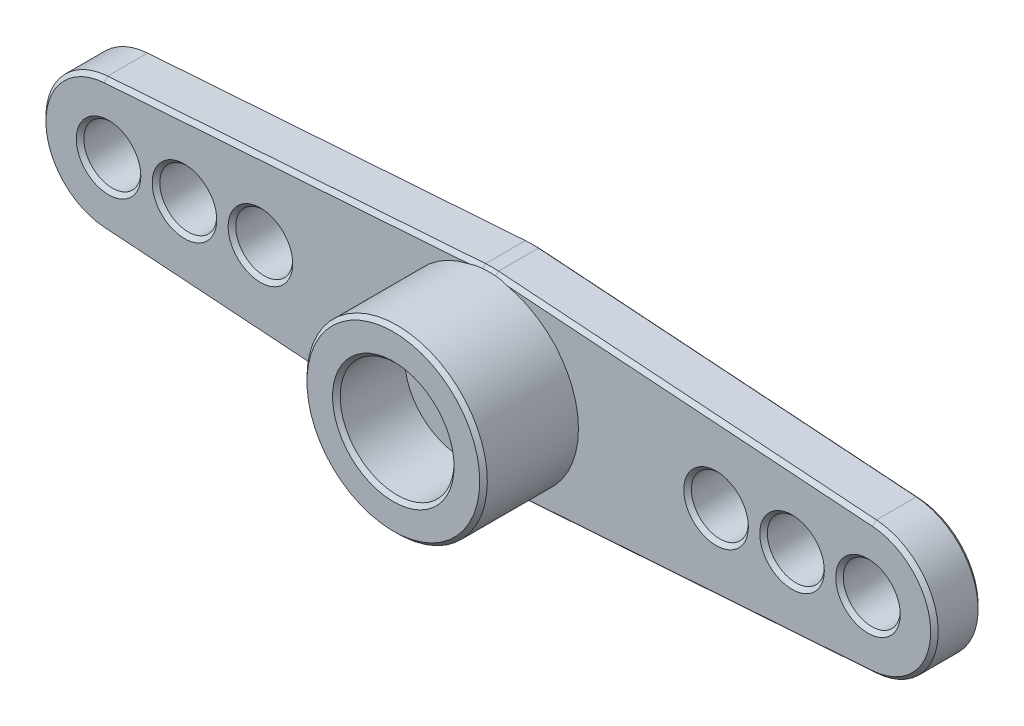
from build123d import *

# Parameters (mm, degrees)
SKETCH_1_R          = 1.5
EXTRUDE_1_DEPTH     = 2.5
SKETCH_2_R          = 4.75
EXTRUDE_2_DEPTH     = 5
SKETCH_3_R          = 3
CUT_EXTRUDE_1_DEPTH = 3.6
CUT_EXTRUDE_START   = -2.2
SKETCH_4_R          = 3
CUT_EXTRUDE_2_DEPTH = 2.2
SKETCH_5_R          = 1.5
CUT_EXTRUDE_3_DEPTH = 3
CHAMFER_1_SIZE      = 0.2


with BuildPart() as part:
    # 草图1 → 凸台-拉伸1 (new body)
    with BuildSketch(Plane.XY):
        with BuildLine():
            Line((0.343, 4.887980258), (20.245, 3.49141447))
            ThreePointArc((20.245, 3.49141447), (23.5, 0), (20.245, -3.49141447))
            Line((20.245, -3.49141447), (0.343, -4.887980258))
            ThreePointArc((0.343, -4.887980258), (0, -4.9), (-0.343, -4.887980258))
            Line((-0.343, -4.887980258), (-20.245, -3.49141447))
            ThreePointArc((-20.245, -3.49141447), (-23.5, 0), (-20.245, 3.49141447))
            Line((-20.245, 3.49141447), (-0.343, 4.887980258))
            ThreePointArc((-0.343, 4.887980258), (0, 4.9), (0.343, 4.887980258))
        make_face()
        with Locations((-12, 0)):
            Circle(SKETCH_1_R, mode=Mode.SUBTRACT)
        with Locations((-16, 0)):
            Circle(SKETCH_1_R, mode=Mode.SUBTRACT)
        with Locations((-20, 0)):
            Circle(SKETCH_1_R, mode=Mode.SUBTRACT)
        with Locations((20, 0)):
            Circle(SKETCH_1_R, mode=Mode.SUBTRACT)
        with Locations((16, 0)):
            Circle(SKETCH_1_R, mode=Mode.SUBTRACT)
        with Locations(Location((12, 0, 0), (0, 0, 180))):
            Circle(SKETCH_1_R, mode=Mode.SUBTRACT)
    extrude(amount=EXTRUDE_1_DEPTH)

    # 草图2 → 凸台-拉伸2 (add)
    with BuildSketch(Plane.XY.offset(2.5)):
        Circle(SKETCH_2_R)
    extrude(amount=EXTRUDE_2_DEPTH)

    # 草图3 → 切除-拉伸1 (cut)
    with BuildSketch(Plane.XY.offset(7.5)):
        Circle(SKETCH_3_R)
    extrude(amount=-CUT_EXTRUDE_1_DEPTH, mode=Mode.SUBTRACT)

    # 草图4 → 切除-拉伸2 (cut)
    with BuildSketch(Plane(origin=(0, 0, 0), x_dir=(-1, 0, 0), z_dir=(0, 0, -1)).offset(CUT_EXTRUDE_START)):
        with Locations(Location((0, 0, 0), (0, 0, 180))):
            Circle(SKETCH_4_R)
    extrude(amount=CUT_EXTRUDE_2_DEPTH, mode=Mode.SUBTRACT)

    # 草图5 → 切除-拉伸3 (cut)
    with BuildSketch(Plane(origin=(0, 0, 2.2), x_dir=(-1, 0, 0), z_dir=(0, 0, -1))):
        Circle(SKETCH_5_R)
    extrude(amount=-CUT_EXTRUDE_3_DEPTH, mode=Mode.SUBTRACT)

    # 倒角1
    # the kernel refuses this chamfer: 0.2 mm, written as the material it takes off along each edge
    with BuildSketch(Plane(origin=(-20, 0, 2.5), x_dir=(-0.06999999999999927, -0.9975469913743413, 0), z_dir=(0.9975469913743413, -0.06999999999999927, 0))) as chamfer_1_piece_1:
        Polygon((3.5, CHAMFER_1_SIZE), (3.5 - CHAMFER_1_SIZE, 0), (3.5, 0), align=None)
    revolve(axis=Axis((-20, 0, 2.5), (0, 0, -1)), revolution_arc=171.972025564, mode=Mode.SUBTRACT)
    with BuildSketch(Plane(origin=(-20.245, 3.49141447, 0), x_dir=(-0.0019247113627411001, 0.027428428988091162, 0.9996219169112966), z_dir=(0.9975469913743413, 0.07000000000000042, 0))) as chamfer_1_piece_2:
        Polygon((CHAMFER_1_SIZE * 0.999621916911, CHAMFER_1_SIZE * 0.0274958766106), (-CHAMFER_1_SIZE * 0.0274958766106, CHAMFER_1_SIZE * 0.999621916911), (0, 0), align=None)
    extrude(amount=19.950939827, mode=Mode.SUBTRACT)
    with BuildSketch(Plane(origin=(0, 0, 0), x_dir=(-0.0700000000000013, 0.9975469913743411, 0), z_dir=(-0.9975469913743411, -0.0700000000000013, 0))) as chamfer_1_piece_3:
        Polygon((4.9, -CHAMFER_1_SIZE), (4.9 - CHAMFER_1_SIZE, 0), (4.9, 0), align=None)
    revolve(axis=Axis((0, 0, 0), (0, 0, -1)), revolution_arc=8.027974436, mode=Mode.SUBTRACT)
    with BuildSketch(Plane(origin=(-0.343, -4.887980258, 2.5), x_dir=(0.06997353418379068, 0.9971698357267157, 0.02749587661058734), z_dir=(-0.9975469913743412, 0.06999999999999992, 0))) as chamfer_1_piece_4_section:
        Polygon((CHAMFER_1_SIZE * 0.999621916911, CHAMFER_1_SIZE * 0.0274958766106), (-CHAMFER_1_SIZE * 0.0274958766106, CHAMFER_1_SIZE * 0.999621916911), (0, 0), align=None)
    chamfer_1_piece_4 = extrude(amount=19.950939827, mode=Mode.PRIVATE)
    chamfer_1_piece_4 = chamfer_1_piece_4 - Plane(origin=(0, 0, 2.433954509), x_dir=(1, 0, 0), z_dir=(0, 0, -1)) * Cylinder(4.75, 41, mode=Mode.PRIVATE)
    add(chamfer_1_piece_4, mode=Mode.SUBTRACT)
    with BuildSketch(Plane(origin=(0, 0, 2.5), x_dir=(0.06999999999999668, -0.9975469913743414, 0), z_dir=(0.9975469913743414, 0.06999999999999668, 0))) as chamfer_1_piece_5_section:
        Polygon((4.9 - CHAMFER_1_SIZE, 0), (4.9, CHAMFER_1_SIZE), (4.9, 0), align=None)
    chamfer_1_piece_5 = revolve(axis=Axis((0, 0, 2.5), (0, 0, -1)), revolution_arc=8.027974436, mode=Mode.PRIVATE)
    chamfer_1_piece_5 = chamfer_1_piece_5 - Plane(origin=(0, 0, 2.429409395), x_dir=(1, 0, 0), z_dir=(0, 0, -1)) * Cylinder(4.75, 20, mode=Mode.PRIVATE)
    add(chamfer_1_piece_5, mode=Mode.SUBTRACT)
    with BuildSketch(Plane(origin=(20.245, -3.49141447, 2.5), x_dir=(-0.06997353418379093, 0.9971698357267157, 0.027495876610587357), z_dir=(-0.9975469913743413, -0.07000000000000017, 0))) as chamfer_1_piece_6_section:
        Polygon((CHAMFER_1_SIZE * 0.999621916911, CHAMFER_1_SIZE * 0.0274958766106), (-CHAMFER_1_SIZE * 0.0274958766106, CHAMFER_1_SIZE * 0.999621916911), (0, 0), align=None)
    chamfer_1_piece_6 = extrude(amount=19.950939827, mode=Mode.PRIVATE)
    chamfer_1_piece_6 = chamfer_1_piece_6 - Plane(origin=(0, 0, 2.433954509), x_dir=(1, 0, 0), z_dir=(0, 0, -1)) * Cylinder(4.75, 41, mode=Mode.PRIVATE)
    add(chamfer_1_piece_6, mode=Mode.SUBTRACT)
    with BuildSketch(Plane(origin=(-12, 0, 0), x_dir=(1, 0, 0), z_dir=(0, -1, 0))) as chamfer_1_piece_7:
        Polygon((1.5 + CHAMFER_1_SIZE, 0), (1.5, CHAMFER_1_SIZE), (1.5, 0), align=None)
    revolve(axis=Axis((-12, 0, 0), (0, 0, 1)), mode=Mode.SUBTRACT)
    with BuildSketch(Plane(origin=(-12, 0, 2.5), x_dir=(1, 0, 0), z_dir=(0, -1, 0))) as chamfer_1_piece_8:
        Polygon((1.5 + CHAMFER_1_SIZE, 0), (1.5, -CHAMFER_1_SIZE), (1.5, 0), align=None)
    revolve(axis=Axis((-12, 0, 2.5), (0, 0, 1)), mode=Mode.SUBTRACT)
    with BuildSketch(Plane(origin=(20, 0, 2.5), x_dir=(0.06999999999999927, 0.9975469913743413, 0), z_dir=(-0.9975469913743413, 0.06999999999999927, 0))) as chamfer_1_piece_9:
        Polygon((3.5 - CHAMFER_1_SIZE, 0), (3.5, CHAMFER_1_SIZE), (3.5, 0), align=None)
    revolve(axis=Axis((20, 0, 2.5), (0, 0, -1)), revolution_arc=171.972025564, mode=Mode.SUBTRACT)
    with BuildSketch(Plane(origin=(16, 0, 2.5), x_dir=(1, 0, 0), z_dir=(0, -1, 0))) as chamfer_1_piece_10:
        Polygon((1.5 + CHAMFER_1_SIZE, 0), (1.5, -CHAMFER_1_SIZE), (1.5, 0), align=None)
    revolve(axis=Axis((16, 0, 2.5), (0, 0, 1)), mode=Mode.SUBTRACT)
    with BuildSketch(Plane(origin=(0.343, 4.887980258, 2.5), x_dir=(-0.06997353418379092, -0.9971698357267157, 0.02749587661058734), z_dir=(0.9975469913743413, -0.07000000000000017, 0))) as chamfer_1_piece_11_section:
        Polygon((CHAMFER_1_SIZE * 0.999621916911, CHAMFER_1_SIZE * 0.0274958766106), (-CHAMFER_1_SIZE * 0.0274958766106, CHAMFER_1_SIZE * 0.999621916911), (0, 0), align=None)
    chamfer_1_piece_11 = extrude(amount=19.950939827, mode=Mode.PRIVATE)
    chamfer_1_piece_11 = chamfer_1_piece_11 - Plane(origin=(0, 0, 2.433954509), x_dir=(1, 0, 0), z_dir=(0, 0, -1)) * Cylinder(4.75, 41, mode=Mode.PRIVATE)
    add(chamfer_1_piece_11, mode=Mode.SUBTRACT)
    with BuildSketch(Plane(origin=(16, 0, 0), x_dir=(1, 0, 0), z_dir=(0, -1, 0))) as chamfer_1_piece_12:
        Polygon((1.5 + CHAMFER_1_SIZE, 0), (1.5, CHAMFER_1_SIZE), (1.5, 0), align=None)
    revolve(axis=Axis((16, 0, 0), (0, 0, 1)), mode=Mode.SUBTRACT)
    with BuildSketch(Plane(origin=(20, 0, 2.5), x_dir=(1, 0, 0), z_dir=(0, -1, 0))) as chamfer_1_piece_13:
        Polygon((1.5 + CHAMFER_1_SIZE, 0), (1.5, -CHAMFER_1_SIZE), (1.5, 0), align=None)
    revolve(axis=Axis((20, 0, 2.5), (0, 0, 1)), mode=Mode.SUBTRACT)
    with BuildSketch(Plane(origin=(20, 0, 0), x_dir=(1, 0, 0), z_dir=(0, -1, 0))) as chamfer_1_piece_14:
        Polygon((1.5 + CHAMFER_1_SIZE, 0), (1.5, CHAMFER_1_SIZE), (1.5, 0), align=None)
    revolve(axis=Axis((20, 0, 0), (0, 0, 1)), mode=Mode.SUBTRACT)
    with BuildSketch(Plane(origin=(-20, 0, 0), x_dir=(1, 0, 0), z_dir=(0, -1, 0))) as chamfer_1_piece_15:
        Polygon((1.5 + CHAMFER_1_SIZE, 0), (1.5, CHAMFER_1_SIZE), (1.5, 0), align=None)
    revolve(axis=Axis((-20, 0, 0), (0, 0, 1)), mode=Mode.SUBTRACT)
    with BuildSketch(Plane(origin=(-20, 0, 2.5), x_dir=(1, 0, 0), z_dir=(0, -1, 0))) as chamfer_1_piece_16:
        Polygon((1.5 + CHAMFER_1_SIZE, 0), (1.5, -CHAMFER_1_SIZE), (1.5, 0), align=None)
    revolve(axis=Axis((-20, 0, 2.5), (0, 0, 1)), mode=Mode.SUBTRACT)
    with BuildSketch(Plane(origin=(-16, 0, 0), x_dir=(1, 0, 0), z_dir=(0, -1, 0))) as chamfer_1_piece_17:
        Polygon((1.5 + CHAMFER_1_SIZE, 0), (1.5, CHAMFER_1_SIZE), (1.5, 0), align=None)
    revolve(axis=Axis((-16, 0, 0), (0, 0, 1)), mode=Mode.SUBTRACT)
    with BuildSketch(Plane(origin=(-16, 0, 2.5), x_dir=(1, 0, 0), z_dir=(0, -1, 0))) as chamfer_1_piece_18:
        Polygon((1.5 + CHAMFER_1_SIZE, 0), (1.5, -CHAMFER_1_SIZE), (1.5, 0), align=None)
    revolve(axis=Axis((-16, 0, 2.5), (0, 0, 1)), mode=Mode.SUBTRACT)
    with BuildSketch(Plane(origin=(0, 0, 2.5), x_dir=(-0.0700000000000013, 0.9975469913743411, 0), z_dir=(-0.9975469913743411, -0.0700000000000013, 0))) as chamfer_1_piece_19_section:
        Polygon((4.9, CHAMFER_1_SIZE), (4.9 - CHAMFER_1_SIZE, 0), (4.9, 0), align=None)
    chamfer_1_piece_19 = revolve(axis=Axis((0, 0, 2.5), (0, 0, -1)), revolution_arc=8.027974436, mode=Mode.PRIVATE)
    chamfer_1_piece_19 = chamfer_1_piece_19 - Plane(origin=(0, 0, 2.429409395), x_dir=(1, 0, 0), z_dir=(0, 0, -1)) * Cylinder(4.75, 20, mode=Mode.PRIVATE)
    add(chamfer_1_piece_19, mode=Mode.SUBTRACT)
    with BuildSketch(Plane(origin=(12, 0, 2.5), x_dir=(-1, 0, 0), z_dir=(0, 1, 0))) as chamfer_1_piece_20:
        Polygon((1.5 + CHAMFER_1_SIZE, 0), (1.5, -CHAMFER_1_SIZE), (1.5, 0), align=None)
    revolve(axis=Axis((12, 0, 2.5), (0, 0, 1)), mode=Mode.SUBTRACT)
    with BuildSketch(Plane(origin=(12, 0, 0), x_dir=(-1, 0, 0), z_dir=(0, 1, 0))) as chamfer_1_piece_21:
        Polygon((1.5 + CHAMFER_1_SIZE, 0), (1.5, CHAMFER_1_SIZE), (1.5, 0), align=None)
    revolve(axis=Axis((12, 0, 0), (0, 0, 1)), mode=Mode.SUBTRACT)
    with BuildSketch(Plane(origin=(0, 0, 7.5), x_dir=(1, 0, 0), z_dir=(0, -1, 0))) as chamfer_1_piece_22:
        Polygon((4.75, -CHAMFER_1_SIZE), (4.75 - CHAMFER_1_SIZE, 0), (4.75, 0), align=None)
    revolve(axis=Axis((0, 0, 7.5), (0, 0, 1)), mode=Mode.SUBTRACT)
    with BuildSketch(Plane(origin=(0, 0, 7.5), x_dir=(1, 0, 0), z_dir=(0, -1, 0))) as chamfer_1_piece_23:
        Polygon((3 + CHAMFER_1_SIZE, 0), (3, -CHAMFER_1_SIZE), (3, 0), align=None)
    revolve(axis=Axis((0, 0, 7.5), (0, 0, 1)), mode=Mode.SUBTRACT)
    with BuildSketch(Plane(origin=(0, 0, 0), x_dir=(1, 0, 0), z_dir=(0, 1, 0))) as chamfer_1_piece_24:
        Polygon((3 + CHAMFER_1_SIZE, 0), (3, -CHAMFER_1_SIZE), (3, 0), align=None)
    revolve(axis=Axis((0, 0, 0), (0, 0, -1)), mode=Mode.SUBTRACT)
    with BuildSketch(Plane(origin=(0, 0, 3.9), x_dir=(-1, 0, 0), z_dir=(0, -1, 0))) as chamfer_1_piece_25:
        Polygon((1.5, CHAMFER_1_SIZE), (1.5 + CHAMFER_1_SIZE, 0), (1.5, 0), align=None)
    revolve(axis=Axis((0, 0, 3.9), (0, 0, -1)), mode=Mode.SUBTRACT)
    with BuildSketch(Plane(origin=(0, 0, 2.2), x_dir=(-1, 0, 0), z_dir=(0, -1, 0))) as chamfer_1_piece_26:
        Polygon((1.5 + CHAMFER_1_SIZE, 0), (1.5, -CHAMFER_1_SIZE), (1.5, 0), align=None)
    revolve(axis=Axis((0, 0, 2.2), (0, 0, -1)), mode=Mode.SUBTRACT)
    with BuildSketch(Plane(origin=(-20.245, 3.49141447, 2.5), x_dir=(-0.0019247113627410969, 0.027428428988091114, -0.9996219169112966), z_dir=(0.9975469913743413, 0.07000000000000042, 0))) as chamfer_1_piece_27_section:
        Polygon((CHAMFER_1_SIZE * 0.999621916911, -CHAMFER_1_SIZE * 0.0274958766106), (-CHAMFER_1_SIZE * 0.0274958766106, -CHAMFER_1_SIZE * 0.999621916911), (0, 0), align=None)
    chamfer_1_piece_27 = extrude(amount=19.950939827, mode=Mode.PRIVATE)
    chamfer_1_piece_27 = chamfer_1_piece_27 - Plane(origin=(0, 0, 2.433954509), x_dir=(1, 0, 0), z_dir=(0, 0, -1)) * Cylinder(4.75, 41, mode=Mode.PRIVATE)
    add(chamfer_1_piece_27, mode=Mode.SUBTRACT)
    with BuildSketch(Plane(origin=(0.343, 4.887980258, 0), x_dir=(-0.06997353418379093, -0.9971698357267158, -0.027495876610586372), z_dir=(0.9975469913743413, -0.07000000000000017, 0)), Plane(origin=(20.245, -3.49141447, 0), x_dir=(-0.06997353418379093, 0.9971698357267158, -0.02749587661058639), z_dir=(-0.9975469913743413, -0.07000000000000017, 0)), Plane(origin=(-0.343, -4.887980258, 0), x_dir=(0.0699735341837907, 0.9971698357267158, -0.027495876610586372), z_dir=(-0.9975469913743412, 0.06999999999999992, 0))) as chamfer_1_piece_28:
        Polygon((CHAMFER_1_SIZE * 0.999621916911, -CHAMFER_1_SIZE * 0.0274958766106), (-CHAMFER_1_SIZE * 0.0274958766106, -CHAMFER_1_SIZE * 0.999621916911), (0, 0), align=None)
    extrude(amount=19.950939827, mode=Mode.SUBTRACT)
    with BuildSketch(Plane(origin=(20, 0, 0), x_dir=(0.06999999999999927, 0.9975469913743413, 0), z_dir=(-0.9975469913743413, 0.06999999999999927, 0))) as chamfer_1_piece_29:
        Polygon((3.5 - CHAMFER_1_SIZE, 0), (3.5, -CHAMFER_1_SIZE), (3.5, 0), align=None)
    revolve(axis=Axis((20, 0, 0), (0, 0, -1)), revolution_arc=171.972025564, mode=Mode.SUBTRACT)
    with BuildSketch(Plane(origin=(0, 0, 0), x_dir=(0.06999999999999668, -0.9975469913743414, 0), z_dir=(0.9975469913743414, 0.06999999999999668, 0))) as chamfer_1_piece_30:
        Polygon((4.9 - CHAMFER_1_SIZE, 0), (4.9, -CHAMFER_1_SIZE), (4.9, 0), align=None)
    revolve(axis=Axis((0, 0, 0), (0, 0, -1)), revolution_arc=8.027974436, mode=Mode.SUBTRACT)
    with BuildSketch(Plane(origin=(-20, 0, 0), x_dir=(-0.06999999999999927, -0.9975469913743413, 0), z_dir=(0.9975469913743413, -0.06999999999999927, 0))) as chamfer_1_piece_31:
        Polygon((3.5, -CHAMFER_1_SIZE), (3.5 - CHAMFER_1_SIZE, 0), (3.5, 0), align=None)
    revolve(axis=Axis((-20, 0, 0), (0, 0, -1)), revolution_arc=171.972025564, mode=Mode.SUBTRACT)


solid = part.part
